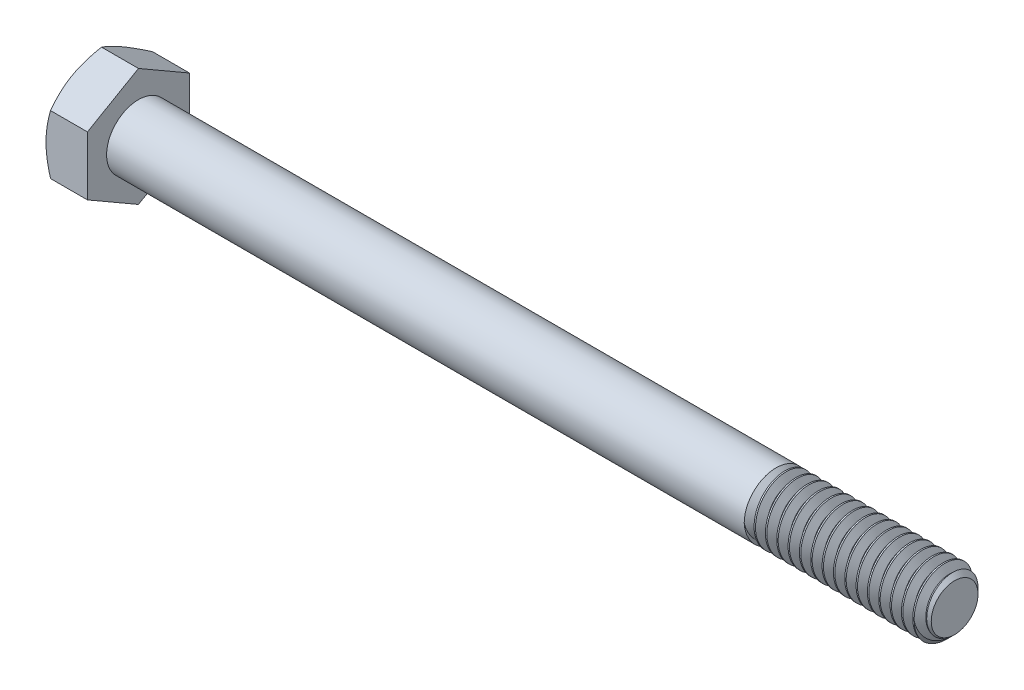
from build123d import *

# Parameters (mm, degrees)
SKETCH5_R           = 3.96875
BOSS_EXTRUDE3_DEPTH = 101.6
CHAMFER1_SIZE       = 1.058333333
CUT_SWEEP1_PITCH    = 1.411111111
BOSS_EXTRUDE4_DEPTH = 5.159375
SKETCH8_OUTSIDE_W   = 411.214
SKETCH8_OUTSIDE_H   = 413.178
SKETCH8_OUTSIDE_R   = 6.35
CUT_EXTRUDE3_DEPTH  = 108.199113826
CUT_EXTRUDE3_DRAFT  = -60
CUT_EXTRUDE4_DEPTH  = 0.254
CIRPATTERN1_COUNT   = 3


with BuildPart() as part:
    # Sketch5 → Boss-Extrude3 (new body)
    with BuildSketch(Plane(origin=(53.3796875, 0, 0), x_dir=(0, 0, -1), z_dir=(1, 0, 0))):
        Circle(SKETCH5_R)
    extrude(amount=-BOSS_EXTRUDE3_DEPTH)

    # Chamfer1
    chamfer1_edges = [part.edges().sort_by_distance(p)[0] for p in [
        (53.3796875, 0, 3.96875),
    ]]
    chamfer(chamfer1_edges, length=CHAMFER1_SIZE)

    # Cut-Sweep1: the profile of Sketch10 profile screwed along a right-hand helix of 16.75 turns, 8 arcs to a turn; built about Z, then put on its axis
    cut_sweep1_z = Axis((0, 0, 0), (0, 0, 1))
    cut_sweep1_corners = [(3.96905, 0, 0.000173205), (3.052206448, 0, -0.529166667), (3.052206448, 0, -0.705555556), (3.96905, 0, -1.234895427)]
    with BuildLine(mode=Mode.PRIVATE) as cut_sweep1_profile:
        Line(cut_sweep1_corners[0], cut_sweep1_corners[1])
        Line(cut_sweep1_corners[1], cut_sweep1_corners[2])
        Line(cut_sweep1_corners[2], cut_sweep1_corners[3])
        Line(cut_sweep1_corners[3], cut_sweep1_corners[0])
    cut_sweep1_cap = Face(cut_sweep1_profile.wire())
    cut_sweep1_turn_angles = [0, 22.5, 45, 67.5, 90, 112.5, 135, 157.5, 180, 202.5, 225, 247.5, 270, 292.5, 315, 337.5, 360]
    cut_sweep1_turn_weights = [1, 0.9238795325112867, 1, 0.9238795325112867, 1, 0.9238795325112867, 1, 0.9238795325112867, 1, 0.9238795325112867, 1, 0.9238795325112867, 1, 0.9238795325112867, 1, 0.9238795325112867, 1]
    cut_sweep1_turn_rails = [Edge.make_bspline([Vector(p[0], p[1], 0).rotate(cut_sweep1_z, cut_sweep1_turn_angles[k]) / cut_sweep1_turn_weights[k] + Vector(0, 0, p[2] + CUT_SWEEP1_PITCH * cut_sweep1_turn_angles[k] / 360) for k in range(17)], [0, 0, 0, 1, 1, 2, 2, 3, 3, 4, 4, 5, 5, 6, 6, 7, 7, 8, 8, 8], 2, cut_sweep1_turn_weights) for p in cut_sweep1_corners]
    cut_sweep1_turn_sides = [Face.make_surface_from_curves(cut_sweep1_turn_rails[p[0]], cut_sweep1_turn_rails[p[1]]) for p in [(0, 1), (1, 2), (2, 3), (3, 0)]]
    cut_sweep1_last_angles = [5760, 5782.5, 5805, 5827.5, 5850, 5872.5, 5895, 5917.5, 5940, 5962.5, 5985, 6007.5, 6030]
    cut_sweep1_last_weights = [1, 0.9238795325112867, 1, 0.9238795325112867, 1, 0.9238795325112867, 1, 0.9238795325112867, 1, 0.9238795325112867, 1, 0.9238795325112473, 1]
    cut_sweep1_last_rails = [Edge.make_bspline([Vector(p[0], p[1], 0).rotate(cut_sweep1_z, cut_sweep1_last_angles[k]) / cut_sweep1_last_weights[k] + Vector(0, 0, p[2] + CUT_SWEEP1_PITCH * cut_sweep1_last_angles[k] / 360) for k in range(13)], [0, 0, 0, 1, 1, 2, 2, 3, 3, 4, 4, 5, 5, 6, 6, 6], 2, cut_sweep1_last_weights) for p in cut_sweep1_corners]
    cut_sweep1_last_sides = [Face.make_surface_from_curves(cut_sweep1_last_rails[p[0]], cut_sweep1_last_rails[p[1]]) for p in [(0, 1), (1, 2), (2, 3), (3, 0)]]
    cut_sweep1 = Plane(origin=(53.3796875, 0, 0), x_dir=(0, 1, 0), z_dir=(-1, 0, 0)) * Solid(Shell([*[p.moved(Location((0, 0, CUT_SWEEP1_PITCH * i))) for i in range(16) for p in cut_sweep1_turn_sides], *cut_sweep1_last_sides, cut_sweep1_cap, cut_sweep1_cap.rotate(cut_sweep1_z, 6030).moved(Location((0, 0, CUT_SWEEP1_PITCH * 6030 / 360)))]))
    add(cut_sweep1, mode=Mode.SUBTRACT)

    # Sketch11 → Revolve1 (revolve)
    with BuildSketch(Plane.XY, mode=Mode.PRIVATE) as revolve1_sk:
        Polygon((-48.2203125, 3.96875), (-48.2203125, 0), (35.1234375, 0), (31.1546875, 3.96875), align=None)
    revolve(revolve1_sk.sketch.rotate(Axis((-48.2203125, 0, 0), (1, 0, 0)), 270), axis=Axis((-48.2203125, 0, 0), (1, 0, 0)))

    # Sketch6 → Boss-Extrude4 (add)
    with BuildSketch(Plane.ZY.offset(48.2203125)):
        Polygon((6.35, 3.666174209), (0, 7.332348419), (-6.35, 3.666174209), (-6.35, -3.666174209), (0, -7.332348419), (6.35, -3.666174209), align=None)
    extrude(amount=BOSS_EXTRUDE4_DEPTH)


with BuildPart() as cut_extrude3_tool:
    # Sketch8 outside → Cut-Extrude3 (with draft: the straight prism first)
    with BuildSketch(Plane.ZY.offset(53.3796875)):
        Rectangle(SKETCH8_OUTSIDE_W, SKETCH8_OUTSIDE_H)
        Circle(SKETCH8_OUTSIDE_R, mode=Mode.SUBTRACT)
    extrude(amount=-CUT_EXTRUDE3_DEPTH)
    # Cut-Extrude3: the draft: its side faces are tilted about the plane it starts from
    cut_extrude3_sides = [cut_extrude3_tool.faces().sort_by_distance(p)[0] for p in [
        (0.719869413, -206.589, 0),
        (0.719869413, 0, 205.607),
        (0.719869413, 206.589, 0),
        (0.719869413, 0, -205.607),
        (0.719869413, 0, -6.35),
    ]]
    draft(cut_extrude3_sides, Plane.ZY.offset(53.3796875), CUT_EXTRUDE3_DRAFT)


with BuildPart() as part_1:
    add(part.part)

    # Cut-Extrude3: cut by cut_extrude3_tool
    add(cut_extrude3_tool.part, mode=Mode.SUBTRACT)

    # Sketch12 → Cut-Extrude4 (cut)
    with BuildSketch(Plane.ZY.offset(53.3796875)):
        with BuildLine():
            Line((0.1905, 4.8895), (0.1905, 2.7305))
            ThreePointArc((0.1905, 2.7305), (0, 2.54), (-0.1905, 2.7305))
            Line((-0.1905, 2.7305), (-0.1905, 4.8895))
            ThreePointArc((-0.1905, 4.8895), (0, 5.08), (0.1905, 4.8895))
        make_face()
    cut_extrude4 = extrude(amount=-CUT_EXTRUDE4_DEPTH, mode=Mode.SUBTRACT)

    # CirPattern1: Cut-Extrude4 ×3 about axis
    cirpattern1_axis = Axis((0, 0, 0), (1, 0, 0))
    for i in range(1, CIRPATTERN1_COUNT):
        add(cut_extrude4.rotate(cirpattern1_axis, i * 360 / CIRPATTERN1_COUNT), mode=Mode.SUBTRACT)


solid = part_1.part
